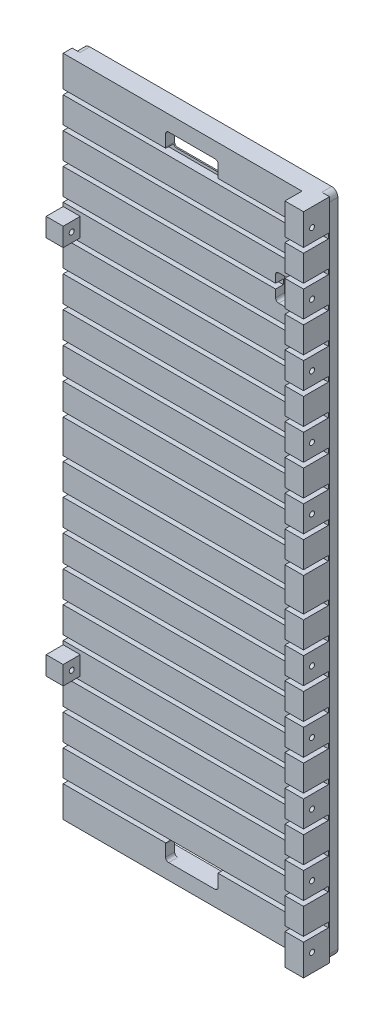
from build123d import *

# Parameters (mm, degrees)
SKETCH1_W                 = 83
SKETCH1_H                 = 214
BOSS_EXTRUDE1_DEPTH       = 8.4
SKETCH2_W                 = 77
SKETCH2_H                 = 5.5
CUT_EXTRUDE1_DEPTH        = 219.148596145
SKETCH3_W                 = 8
SKETCH3_H                 = 1.6
CUT_EXTRUDE2_DEPTH        = 136.678148572
LPATTERN1_COUNT           = 10
LPATTERN1_PITCH           = 10
MIRROR1_COPY_1_SKETCH_W   = 8
MIRROR1_COPY_1_SKETCH_H   = 1.6
MIRROR1_COPY_1_DEPTH      = 136.678148572
MIRROR1_COPY_2_SKETCH_W   = 8
MIRROR1_COPY_2_SKETCH_H   = 1.6
MIRROR1_COPY_2_DEPTH      = 136.678148572
MIRROR1_COPY_3_SKETCH_W   = 8
MIRROR1_COPY_3_SKETCH_H   = 1.6
MIRROR1_COPY_3_DEPTH      = 136.678148572
MIRROR1_COPY_4_SKETCH_W   = 8
MIRROR1_COPY_4_SKETCH_H   = 1.6
MIRROR1_COPY_4_DEPTH      = 136.678148572
MIRROR1_COPY_5_SKETCH_W   = 8
MIRROR1_COPY_5_SKETCH_H   = 1.6
MIRROR1_COPY_5_DEPTH      = 136.678148572
MIRROR1_COPY_6_SKETCH_W   = 8
MIRROR1_COPY_6_SKETCH_H   = 1.6
MIRROR1_COPY_6_DEPTH      = 136.678148572
MIRROR1_COPY_7_SKETCH_W   = 8
MIRROR1_COPY_7_SKETCH_H   = 1.6
MIRROR1_COPY_7_DEPTH      = 136.678148572
MIRROR1_COPY_8_SKETCH_W   = 8
MIRROR1_COPY_8_SKETCH_H   = 1.6
MIRROR1_COPY_8_DEPTH      = 136.678148572
MIRROR1_COPY_9_SKETCH_W   = 8
MIRROR1_COPY_9_SKETCH_H   = 1.6
MIRROR1_COPY_9_DEPTH      = 136.678148572
MIRROR1_COPY_10_SKETCH_W  = 8
MIRROR1_COPY_10_SKETCH_H  = 1.6
MIRROR1_COPY_10_DEPTH     = 136.678148572
BOSS_EXTRUDE2_DEPTH       = 3.18
SKETCH5_W                 = 5.5
SKETCH5_H                 = 6
BOSS_EXTRUDE3_DEPTH       = 5.5
CUT_EXTRUDE3_DEPTH        = 116.073063746
M2X0_4_TAPPED_HOLE1_D     = 1.6
M2X0_4_TAPPED_HOLE2_D     = 1.6
M2X0_4_TAPPED_HOLE2_DEPTH = 4
M2X0_4_TAPPED_HOLE2_TIP   = 0.480688495
CUT_EXTRUDE4_DEPTH        = 10


with BuildPart() as part:
    # Sketch1 → Boss-Extrude1 (new body)
    with BuildSketch(Plane.XY):
        Rectangle(SKETCH1_W, SKETCH1_H)
    extrude(amount=BOSS_EXTRUDE1_DEPTH)

    # Sketch2 → Cut-Extrude1 (cut, through all)
    with BuildSketch(Plane(origin=(0, 107, 0), x_dir=(1, 0, 0), z_dir=(0, 1, 0))):
        with Locations((-3, -5.65)):
            Rectangle(SKETCH2_W, SKETCH2_H)
    extrude(amount=-CUT_EXTRUDE1_DEPTH, mode=Mode.SUBTRACT)

    # Sketch3 → Cut-Extrude2 (cut, through all)
    with BuildSketch(Plane(origin=(41.5, 0, 0), x_dir=(0, 0, -1), z_dir=(1, 0, 0))):
        with Locations((-4.4, 96.2)):
            Rectangle(SKETCH3_W, SKETCH3_H)
    cut_extrude2 = extrude(amount=-CUT_EXTRUDE2_DEPTH, mode=Mode.SUBTRACT)

    # LPattern1: Cut-Extrude2 ×10
    with Locations(*[(0, -i * LPATTERN1_PITCH, 0) for i in range(1, LPATTERN1_COUNT)]):
        add(cut_extrude2, mode=Mode.SUBTRACT)

    # Mirror1 copy 1 sketch → Mirror1 copy 1 (cut, through all)
    with BuildSketch(Plane(origin=(41.5, 10, 0), x_dir=(0, 0, -1), z_dir=(1, 0, 0))):
        with Locations((-4.4, -96.2)):
            Rectangle(MIRROR1_COPY_1_SKETCH_W, MIRROR1_COPY_1_SKETCH_H)
    extrude(amount=-MIRROR1_COPY_1_DEPTH, mode=Mode.SUBTRACT)

    # Mirror1 copy 2 sketch → Mirror1 copy 2 (cut, through all)
    with BuildSketch(Plane(origin=(41.5, 20, 0), x_dir=(0, 0, -1), z_dir=(1, 0, 0))):
        with Locations((-4.4, -96.2)):
            Rectangle(MIRROR1_COPY_2_SKETCH_W, MIRROR1_COPY_2_SKETCH_H)
    extrude(amount=-MIRROR1_COPY_2_DEPTH, mode=Mode.SUBTRACT)

    # Mirror1 copy 3 sketch → Mirror1 copy 3 (cut, through all)
    with BuildSketch(Plane(origin=(41.5, 30, 0), x_dir=(0, 0, -1), z_dir=(1, 0, 0))):
        with Locations((-4.4, -96.2)):
            Rectangle(MIRROR1_COPY_3_SKETCH_W, MIRROR1_COPY_3_SKETCH_H)
    extrude(amount=-MIRROR1_COPY_3_DEPTH, mode=Mode.SUBTRACT)

    # Mirror1 copy 4 sketch → Mirror1 copy 4 (cut, through all)
    with BuildSketch(Plane(origin=(41.5, 40, 0), x_dir=(0, 0, -1), z_dir=(1, 0, 0))):
        with Locations((-4.4, -96.2)):
            Rectangle(MIRROR1_COPY_4_SKETCH_W, MIRROR1_COPY_4_SKETCH_H)
    extrude(amount=-MIRROR1_COPY_4_DEPTH, mode=Mode.SUBTRACT)

    # Mirror1 copy 5 sketch → Mirror1 copy 5 (cut, through all)
    with BuildSketch(Plane(origin=(41.5, 50, 0), x_dir=(0, 0, -1), z_dir=(1, 0, 0))):
        with Locations((-4.4, -96.2)):
            Rectangle(MIRROR1_COPY_5_SKETCH_W, MIRROR1_COPY_5_SKETCH_H)
    extrude(amount=-MIRROR1_COPY_5_DEPTH, mode=Mode.SUBTRACT)

    # Mirror1 copy 6 sketch → Mirror1 copy 6 (cut, through all)
    with BuildSketch(Plane(origin=(41.5, 60, 0), x_dir=(0, 0, -1), z_dir=(1, 0, 0))):
        with Locations((-4.4, -96.2)):
            Rectangle(MIRROR1_COPY_6_SKETCH_W, MIRROR1_COPY_6_SKETCH_H)
    extrude(amount=-MIRROR1_COPY_6_DEPTH, mode=Mode.SUBTRACT)

    # Mirror1 copy 7 sketch → Mirror1 copy 7 (cut, through all)
    with BuildSketch(Plane(origin=(41.5, 70, 0), x_dir=(0, 0, -1), z_dir=(1, 0, 0))):
        with Locations((-4.4, -96.2)):
            Rectangle(MIRROR1_COPY_7_SKETCH_W, MIRROR1_COPY_7_SKETCH_H)
    extrude(amount=-MIRROR1_COPY_7_DEPTH, mode=Mode.SUBTRACT)

    # Mirror1 copy 8 sketch → Mirror1 copy 8 (cut, through all)
    with BuildSketch(Plane(origin=(41.5, 80, 0), x_dir=(0, 0, -1), z_dir=(1, 0, 0))):
        with Locations((-4.4, -96.2)):
            Rectangle(MIRROR1_COPY_8_SKETCH_W, MIRROR1_COPY_8_SKETCH_H)
    extrude(amount=-MIRROR1_COPY_8_DEPTH, mode=Mode.SUBTRACT)

    # Mirror1 copy 9 sketch → Mirror1 copy 9 (cut, through all)
    with BuildSketch(Plane(origin=(41.5, 90, 0), x_dir=(0, 0, -1), z_dir=(1, 0, 0))):
        with Locations((-4.4, -96.2)):
            Rectangle(MIRROR1_COPY_9_SKETCH_W, MIRROR1_COPY_9_SKETCH_H)
    extrude(amount=-MIRROR1_COPY_9_DEPTH, mode=Mode.SUBTRACT)

    # Mirror1 copy 10 sketch → Mirror1 copy 10 (cut, through all)
    with BuildSketch(Plane(origin=(41.5, 0, 0), x_dir=(0, 0, -1), z_dir=(1, 0, 0))):
        with Locations((-4.4, -96.2)):
            Rectangle(MIRROR1_COPY_10_SKETCH_W, MIRROR1_COPY_10_SKETCH_H)
    extrude(amount=-MIRROR1_COPY_10_DEPTH, mode=Mode.SUBTRACT)

    # Sketch4 → Boss-Extrude2 (add)
    with BuildSketch(Plane(origin=(0, 0, 0), x_dir=(-1, 0, 0), z_dir=(0, 0, -1))):
        with BuildLine():
            Line((-39, 107), (39, 107))
            ThreePointArc((39, 107), (40.414213562, 106.414213562), (41, 105))
            Line((41, 105), (41, -105))
            ThreePointArc((41, -105), (40.414213562, -106.414213562), (39, -107))
            Line((39, -107), (-39, -107))
            ThreePointArc((-39, -107), (-40.414213562, -106.414213562), (-41, -105))
            Line((-41, -105), (-41, 105))
            ThreePointArc((-41, 105), (-40.414213562, 106.414213562), (-39, 107))
        make_face()
        with BuildLine():
            Line((-33.5, -102), (33.5, -102))
            ThreePointArc((33.5, -102), (34.914213562, -101.414213562), (35.5, -100))
            Line((35.5, -100), (35.5, 100))
            ThreePointArc((35.5, 100), (34.914213562, 101.414213562), (33.5, 102))
            Line((33.5, 102), (-33.5, 102))
            ThreePointArc((-33.5, 102), (-34.914213562, 101.414213562), (-35.5, 100))
            Line((-35.5, 100), (-35.5, -100))
            ThreePointArc((-35.5, -100), (-34.914213562, -101.414213562), (-33.5, -102))
        make_face(mode=Mode.SUBTRACT)
    extrude(amount=BOSS_EXTRUDE2_DEPTH)

    # Sketch5 → Boss-Extrude3 (add)
    with BuildSketch(Plane.XY.offset(2.9)):
        with Locations((-38.75, 61.2)):
            Rectangle(SKETCH5_W, SKETCH5_H)
    boss_extrude3 = extrude(amount=BOSS_EXTRUDE3_DEPTH)

    # Mirror2: Boss-Extrude3 across plane
    add(boss_extrude3.mirror(Plane.ZX))

    # Sketch6 → Cut-Extrude3 (cut, through all)
    with BuildSketch(Plane(origin=(0, 0, 0), x_dir=(-1, 0, 0), z_dir=(0, 0, -1))):
        with BuildLine():
            Line((-7.475, 96.3), (7.475, 96.3))
            ThreePointArc((7.475, 96.3), (8.182106781, 96.592893219), (8.475, 97.3))
            Line((8.475, 97.3), (8.475, 101))
            ThreePointArc((8.475, 101), (8.182106781, 101.707106781), (7.475, 102))
            Line((7.475, 102), (-7.475, 102))
            ThreePointArc((-7.475, 102), (-8.182106781, 101.707106781), (-8.475, 101))
            Line((-8.475, 101), (-8.475, 97.3))
            ThreePointArc((-8.475, 97.3), (-8.182106781, 96.592893219), (-7.475, 96.3))
        make_face()
    cut_extrude3 = extrude(amount=-CUT_EXTRUDE3_DEPTH, mode=Mode.SUBTRACT)

    # Mirror3: Cut-Extrude3 across plane
    add(cut_extrude3.mirror(Plane.ZX), mode=Mode.SUBTRACT)

    # M2x0.4 Tapped Hole1 (through all)
    with Locations(Plane(origin=(41.5, 0, 0), x_dir=(0, 0, -1), z_dir=(1, 0, 0))):
        with Locations((-5.65, 101.2), (-5.65, 81.2), (-5.65, 61.2), (-5.65, 41.2), (-5.65, 21.2), (-5.65, -101.2), (-5.65, -81.2), (-5.65, -61.2), (-5.65, -41.2), (-5.65, -21.2)):
            Hole(M2X0_4_TAPPED_HOLE1_D / 2)

    # M2x0.4 Tapped Hole2
    with Locations(Plane(origin=(0, 0, -3.18), x_dir=(-1, 0, 0), z_dir=(0, 0, -1))):
        with Locations((-37.5, 101.2), (37.5, 101.2), (37.5, 81.2), (37.5, 61.2), (37.5, 41.2), (37.5, 21.2), (-37.5, 81.2), (-37.5, 61.2), (-37.5, 41.2), (-37.5, 21.2), (37.5, -101.2), (-37.5, -21.2), (-37.5, -41.2), (-37.5, -61.2), (-37.5, -81.2), (37.5, -21.2), (37.5, -41.2), (37.5, -61.2), (37.5, -81.2), (-37.5, -101.2)):
            Hole(M2X0_4_TAPPED_HOLE2_D / 2, depth=M2X0_4_TAPPED_HOLE2_DEPTH)
            with Locations((0, 0, -(M2X0_4_TAPPED_HOLE2_DEPTH + M2X0_4_TAPPED_HOLE2_TIP / 2))):  # 118° drill point
                Cone(0, M2X0_4_TAPPED_HOLE2_D / 2, M2X0_4_TAPPED_HOLE2_TIP, mode=Mode.SUBTRACT)

    # Sketch12 → Cut-Extrude4 (cut)
    with BuildSketch(Plane.XY.offset(2.9)):
        with BuildLine():
            Line((28, 71.95), (34.5, 71.95))
            ThreePointArc((34.5, 71.95), (35.207106781, 72.242893219), (35.5, 72.95))
            Line((35.5, 72.95), (35.5, 79.45))
            ThreePointArc((35.5, 79.45), (35.207106781, 80.157106781), (34.5, 80.45))
            Line((34.5, 80.45), (28, 80.45))
            ThreePointArc((28, 80.45), (27.292893219, 80.157106781), (27, 79.45))
            Line((27, 79.45), (27, 72.95))
            ThreePointArc((27, 72.95), (27.292893219, 72.242893219), (28, 71.95))
        make_face()
    extrude(amount=-CUT_EXTRUDE4_DEPTH, mode=Mode.SUBTRACT)


solid = part.part
